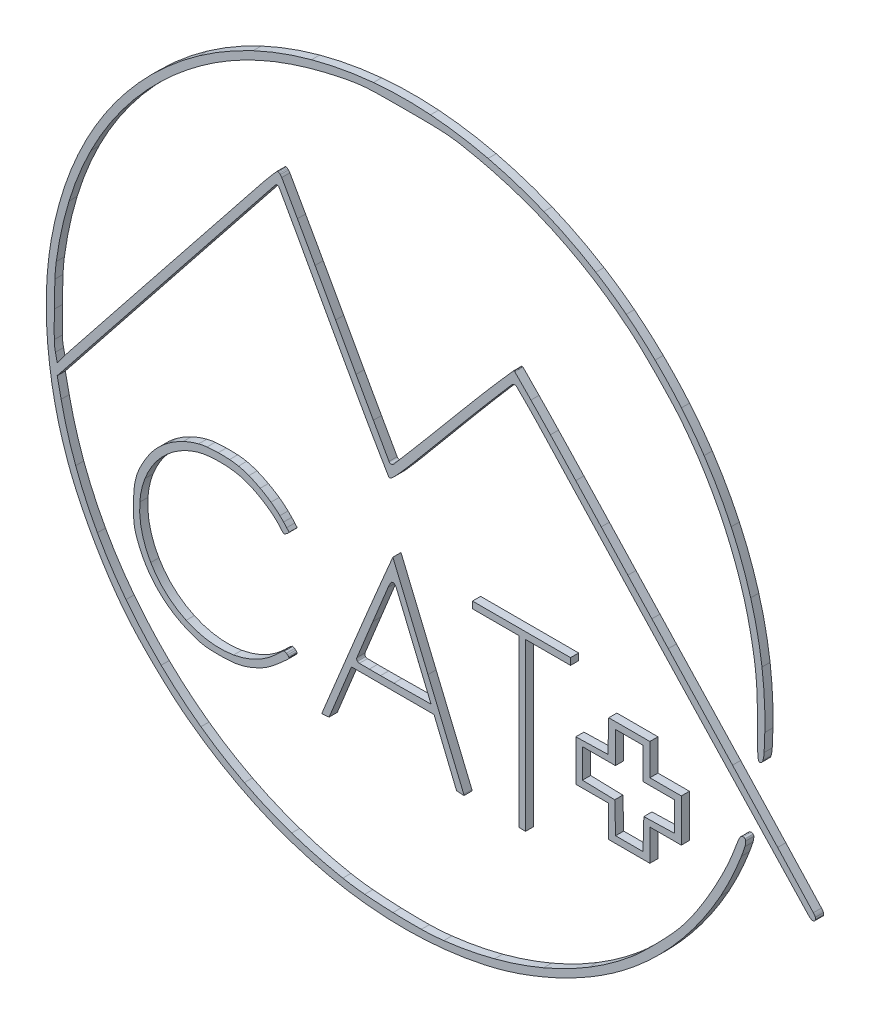
from build123d import *

# Parameters (mm, degrees)
BOSS_EXTRUDE1_DEPTH   = 1.3
BOSS_EXTRUDE1_2_DEPTH = 1.3
BOSS_EXTRUDE1_3_DEPTH = 1.3
BOSS_EXTRUDE1_4_DEPTH = 1.3
BOSS_EXTRUDE1_5_DEPTH = 1.3


with BuildPart() as part:
    # Sketch1 → Boss-Extrude1 (new body)
    with BuildSketch(Plane.XY):
        with BuildLine():
            Line((-31.815838724, 8.425255359), (-33.682591288, 3.900470302))
            Line((-33.682591288, 3.900470302), (-35.328575676, -0.094963077))
            ThreePointArc((-35.328575676, -0.094963077), (-35.391110564, -0.25152532), (-35.450284856, -0.409388398))
            ThreePointArc((-35.450284856, -0.409388398), (-35.229552005, -0.397854852), (-35.009108398, -0.381710805))
            Line((-35.009108398, -0.381710805), (-34.281885857, -0.320806981))
            Line((-34.281885857, -0.320806981), (-32.567121432, 3.880706873))
            Line((-32.567121432, 3.880706873), (-30.706701445, 8.439105823))
            Line((-30.706701445, 8.439105823), (-24.097582966, 8.439105823))
            Line((-24.097582966, 8.439105823), (-17.489142556, 8.439105823))
            Line((-17.489142556, 8.439105823), (-15.612473722, 3.881572554))
            Line((-15.612473722, 3.881572554), (-13.881916352, -0.321125114))
            Line((-13.881916352, -0.321125114), (-13.196712386, -0.379858018))
            ThreePointArc((-13.196712386, -0.379858018), (-13.041807344, -0.390218714), (-12.886623029, -0.3947733))
            ThreePointArc((-12.886623029, -0.3947733), (-12.781426044, -0.393056682), (-12.67647411, -0.38567804))
            ThreePointArc((-12.67647411, -0.38567804), (-12.696631397, -0.311295888), (-12.723189489, -0.238951652))
            Line((-12.723189489, -0.238951652), (-18.454242914, 13.486461288))
            Line((-18.454242914, 13.486461288), (-24.079007465, 26.952053591))
            Line((-24.079007465, 26.952053591), (-25.584755443, 23.397018841))
            ThreePointArc((-25.584755443, 23.397018841), (-26.517769308, 21.185389488), (-27.445091809, 18.971367752))
            ThreePointArc((-27.445091809, 18.971367752), (-28.539429645, 16.343399387), (-29.629692848, 13.713737968))
            Line((-29.629692848, 13.713737968), (-31.815838724, 8.425255359))
        make_face()
        with BuildLine():
            Line((-23.92032783, 9.571350871), (-17.966044582, 9.64093294))
            Line((-17.966044582, 9.64093294), (-20.732755734, 16.279389691))
            ThreePointArc((-20.732755734, 16.279389691), (-21.237325347, 17.489708875), (-21.742139439, 18.69992611))
            Line((-21.742139439, 18.69992611), (-22.625320846, 20.814812018))
            Line((-22.625320846, 20.814812018), (-23.383297854, 22.627703207))
            ThreePointArc((-23.383297854, 22.627703207), (-23.456956867, 22.8021917), (-23.531769074, 22.976188878))
            ThreePointArc((-23.531769074, 22.976188878), (-23.582733412, 23.081511322), (-23.642213646, 23.18226986))
            ThreePointArc((-23.642213646, 23.18226986), (-23.720580769, 23.28125606), (-23.816245789, 23.363644637))
            ThreePointArc((-23.816245789, 23.363644637), (-23.956980287, 23.428590129), (-24.111647193, 23.438702698))
            ThreePointArc((-24.111647193, 23.438702698), (-24.278166717, 23.378915157), (-24.401733002, 23.25228706))
            ThreePointArc((-24.401733002, 23.25228706), (-24.641206142, 22.821415523), (-24.845998227, 22.373020757))
            Line((-24.845998227, 22.373020757), (-27.278105284, 16.425394876))
            Line((-27.278105284, 16.425394876), (-29.834419937, 10.156028065))
            ThreePointArc((-29.834419937, 10.156028065), (-29.857759174, 9.908341994), (-29.740174725, 9.689100102))
            ThreePointArc((-29.740174725, 9.689100102), (-29.602150213, 9.596544093), (-29.439321743, 9.563313566))
            Line((-29.439321743, 9.563313566), (-27.844629137, 9.55355839))
            ThreePointArc((-27.844629137, 9.55355839), (-26.943065988, 9.551122672), (-26.041502523, 9.5534385))
            ThreePointArc((-26.041502523, 9.5534385), (-24.980900659, 9.560675474), (-23.92032783, 9.571350871))
        make_face(mode=Mode.SUBTRACT)
    extrude(amount=BOSS_EXTRUDE1_DEPTH)


with BuildPart() as body_2:
    # Sketch1 → Boss-Extrude1 2 (new body)
    with BuildSketch(Plane.XY):
        Polygon((-3.910313521, 26.165694971), (-3.910313521, 12.57075311), (-3.910313521, -0.424188751), (-3.371893764, -0.424188751), (-2.833474007, -0.424188751), (-2.833474007, 12.57075311), (-2.833474007, 26.165694971), (1.059753523, 26.165694971), (4.352981053, 26.165694971), (4.352981053, 26.704114728), (4.352981053, 27.242534485), (-3.491668015, 27.242534485), (-11.336317083, 27.242534485), (-11.336317083, 26.704114728), (-11.336317083, 26.165694971), (-7.923315302, 26.165694971), align=None)
    extrude(amount=BOSS_EXTRUDE1_2_DEPTH)


with BuildPart() as body_3:
    # Sketch1 → Boss-Extrude1 3 (new body)
    with BuildSketch(Plane.XY):
        Polygon((7.475594057, 16.75428763), (5.192529555, 16.694008143), (5.192529555, 13.401068462), (5.192529555, 10.115945337), (7.527563077, 10.115945337), (10.462596599, 10.115945337), (10.462596599, 7.300686066), (10.462596599, 5.085426795), (13.755824128, 5.085426795), (17.049051658, 5.085426795), (17.049051658, 7.300686066), (17.049051658, 10.115945337), (19.864310929, 10.115945337), (22.0795702, 10.115945337), (22.0795702, 13.528947118), (22.0795702, 16.941948899), (19.864310929, 16.941948899), (17.049051658, 16.941948899), (17.049051658, 19.75720817), (17.049051658, 21.972467441), (13.763928533, 21.972467441), (10.470988852, 21.972467441), (10.410709366, 19.689402939), (10.33520707, 16.829789926), align=None)
        Polygon((9.204402591, 15.865109385), (6.269369069, 15.865109385), (6.269369069, 13.537051523), (6.269369069, 11.216809738), (9.136597359, 11.141106643), (11.42767546, 11.080615361), (11.488044998, 8.909300711), (11.564421398, 6.162266309), (13.755824128, 6.162266309), (15.947226859, 6.162266309), (16.023603259, 8.909300711), (16.083983856, 11.081013139), (18.255696285, 11.141393737), (21.002730686, 11.217770137), (21.002730686, 13.537327243), (21.002730686, 15.865109385), (18.187471415, 15.865109385), (15.972212144, 15.865109385), (15.972212144, 18.080368656), (15.972212144, 20.895627927), (13.755824128, 20.895627927), (11.539436113, 20.895627927), (11.539436113, 18.080368656), (11.539436113, 15.865109385), align=None, mode=Mode.SUBTRACT)
    extrude(amount=BOSS_EXTRUDE1_3_DEPTH)


with BuildPart() as body_4:
    # Sketch1 → Boss-Extrude1 4 (new body)
    with BuildSketch(Plane.XY):
        with BuildLine():
            Line((28.680505607, 25.268543656), (42.484069198, 10.525843179))
            ThreePointArc((42.484069198, 10.525843179), (42.676116553, 10.356318127), (42.896722792, 10.226111302))
            ThreePointArc((42.896722792, 10.226111302), (43.036837537, 10.184887309), (43.182867195, 10.187513807))
            ThreePointArc((43.182867195, 10.187513807), (43.319842008, 10.233441175), (43.436538227, 10.318608158))
            ThreePointArc((43.436538227, 10.318608158), (43.521595885, 10.434543328), (43.567531365, 10.570799339))
            ThreePointArc((43.567531365, 10.570799339), (43.570177454, 10.715594277), (43.529085711, 10.854461279))
            ThreePointArc((43.529085711, 10.854461279), (43.389107636, 11.100844868), (43.213449674, 11.323202724))
            Line((43.213449674, 11.323202724), (37.503851719, 17.51285194))
            ThreePointArc((37.503851719, 17.51285194), (33.89547054, 21.412160992), (30.278340783, 25.303355942))
            Line((30.278340783, 25.303355942), (20.000786453, 36.316706173))
            Line((20.000786453, 36.316706173), (17.371265182, 39.132202231))
            Line((17.371265182, 39.132202231), (13.525684351, 43.254315787))
            Line((13.525684351, 43.254315787), (9.268413789, 47.820240906))
            Line((9.268413789, 47.820240906), (5.195340606, 52.191187157))
            ThreePointArc((5.195340606, 52.191187157), (3.169892585, 54.357924541), (1.136968408, 56.517649031))
            ThreePointArc((1.136968408, 56.517649031), (-0.417548425, 58.150761239), (-1.984610164, 59.771839761))
            ThreePointArc((-1.984610164, 59.771839761), (-3.272327213, 61.091090503), (-4.562656485, 62.407786402))
            ThreePointArc((-4.562656485, 62.407786402), (-4.615439782, 62.443579781), (-4.677960761, 62.456164278))
            ThreePointArc((-4.677960761, 62.456164278), (-4.740692547, 62.442676774), (-4.792337597, 62.404598189))
            ThreePointArc((-4.792337597, 62.404598189), (-5.999188839, 61.03553164), (-7.202805728, 59.663620738))
            ThreePointArc((-7.202805728, 59.663620738), (-8.722792724, 57.912670456), (-10.228498022, 56.14942376))
            ThreePointArc((-10.228498022, 56.14942376), (-12.321481363, 53.67048492), (-14.406844516, 51.185132319))
            ThreePointArc((-14.406844516, 51.185132319), (-16.236071462, 49.001859179), (-18.068859072, 46.821574243))
            ThreePointArc((-18.068859072, 46.821574243), (-19.621860207, 44.982205714), (-21.179807314, 43.147024546))
            Line((-21.179807314, 43.147024546), (-23.981897106, 39.856563162))
            ThreePointArc((-23.981897106, 39.856563162), (-24.135123531, 39.740334842), (-24.322962467, 39.699056589))
            ThreePointArc((-24.322962467, 39.699056589), (-24.533542455, 39.756098897), (-24.686540619, 39.911628053))
            Line((-24.686540619, 39.911628053), (-27.19564382, 44.370458933))
            ThreePointArc((-27.19564382, 44.370458933), (-28.587394583, 46.852147482), (-29.972673324, 49.337454514))
            ThreePointArc((-29.972673324, 49.337454514), (-31.607869506, 52.285598656), (-33.238429188, 55.236309682))
            ThreePointArc((-33.238429188, 55.236309682), (-34.876799211, 58.200764007), (-36.520159048, 61.162455116))
            ThreePointArc((-36.520159048, 61.162455116), (-37.932068217, 63.693990942), (-39.350746614, 66.221739495))
            Line((-39.350746614, 66.221739495), (-41.858350193, 70.670115722))
            ThreePointArc((-41.858350193, 70.670115722), (-41.963304128, 70.83061318), (-42.088245517, 70.976093112))
            ThreePointArc((-42.088245517, 70.976093112), (-42.152084602, 71.034445058), (-42.221989828, 71.085372829))
            ThreePointArc((-42.221989828, 71.085372829), (-42.296600768, 71.127919418), (-42.375493229, 71.161875039))
            ThreePointArc((-42.375493229, 71.161875039), (-42.442843329, 71.181905003), (-42.512141161, 71.193525931))
            ThreePointArc((-42.512141161, 71.193525931), (-42.527436998, 71.193325825), (-42.542263754, 71.189561523))
            ThreePointArc((-42.542263754, 71.189561523), (-42.600386043, 71.158853791), (-42.649574125, 71.11524533))
            ThreePointArc((-42.649574125, 71.11524533), (-43.06109761, 70.648670322), (-43.469792687, 70.179615793))
            ThreePointArc((-43.469792687, 70.179615793), (-43.945955175, 69.622716397), (-44.415046327, 69.059847723))
            ThreePointArc((-44.415046327, 69.059847723), (-44.945359092, 68.409682413), (-45.470135327, 67.755040173))
            Line((-45.470135327, 67.755040173), (-47.192464721, 65.58979085))
            Line((-47.192464721, 65.58979085), (-51.492662408, 60.189397523))
            Line((-51.492662408, 60.189397523), (-56.621686965, 53.749412526))
            Line((-56.621686965, 53.749412526), (-62.190153691, 46.759073506))
            Line((-62.190153691, 46.759073506), (-67.609123391, 39.952687203))
            Line((-67.609123391, 39.952687203), (-72.269670896, 34.089372843))
            Line((-72.269670896, 34.089372843), (-76.339105294, 28.96333216))
            ThreePointArc((-76.339105294, 28.96333216), (-76.572370847, 28.663987988), (-76.800267428, 28.360536345))
            Line((-76.800267428, 28.360536345), (-77.781718408, 27.029172265))
            Line((-77.781718408, 27.029172265), (-78.076102453, 28.35368493))
            ThreePointArc((-78.076102453, 28.35368493), (-78.213885922, 29.178299976), (-78.263408579, 30.01287877))
            ThreePointArc((-78.263408579, 30.01287877), (-78.267254701, 32.127745865), (-78.252892013, 34.242567686))
            ThreePointArc((-78.252892013, 34.242567686), (-78.217107794, 36.345438106), (-78.156437377, 38.447737708))
            ThreePointArc((-78.156437377, 38.447737708), (-78.08040583, 39.7251138), (-77.94143361, 40.99718188))
            ThreePointArc((-77.94143361, 40.99718188), (-77.108822901, 45.73877938), (-75.896931242, 50.397889387))
            ThreePointArc((-75.896931242, 50.397889387), (-74.333286218, 54.851971882), (-72.394400419, 59.155988437))
            ThreePointArc((-72.394400419, 59.155988437), (-70.099602686, 63.268081973), (-67.460576153, 67.168203618))
            ThreePointArc((-67.460576153, 67.168203618), (-64.458660186, 70.889485992), (-61.162117528, 74.35246859))
            ThreePointArc((-61.162117528, 74.35246859), (-58.077428316, 77.133311455), (-54.803808083, 79.689051103))
            ThreePointArc((-54.803808083, 79.689051103), (-51.431340081, 81.944498124), (-47.897307536, 83.937284031))
            ThreePointArc((-47.897307536, 83.937284031), (-44.180374156, 85.677692756), (-40.343445323, 87.134605044))
            ThreePointArc((-40.343445323, 87.134605044), (-36.235766889, 88.372097974), (-32.055869453, 89.337949042))
            ThreePointArc((-32.055869453, 89.337949042), (-31.015895753, 89.530850711), (-29.971958601, 89.701002324))
            ThreePointArc((-29.971958601, 89.701002324), (-29.126969443, 89.810992376), (-28.278075634, 89.885045003))
            ThreePointArc((-28.278075634, 89.885045003), (-27.226744143, 89.939842254), (-26.174304611, 89.96575894))
            ThreePointArc((-26.174304611, 89.96575894), (-24.175651878, 89.982904529), (-22.176941183, 89.990796222))
            ThreePointArc((-22.176941183, 89.990796222), (-20.410115625, 89.98900776), (-18.643324271, 89.977869348))
            ThreePointArc((-18.643324271, 89.977869348), (-17.515639321, 89.956942061), (-16.388564568, 89.914353301))
            ThreePointArc((-16.388564568, 89.914353301), (-15.541535317, 89.861757038), (-14.696408917, 89.784385926))
            ThreePointArc((-14.696408917, 89.784385926), (-13.915911322, 89.686687101), (-13.13958495, 89.560042242))
            ThreePointArc((-13.13958495, 89.560042242), (-9.31011007, 88.74650119), (-5.534293157, 87.71212527))
            ThreePointArc((-5.534293157, 87.71212527), (-1.971228296, 86.495193484), (1.504682, 85.047988663))
            ThreePointArc((1.504682, 85.047988663), (4.806259654, 83.40933124), (7.990801623, 81.553447191))
            ThreePointArc((7.990801623, 81.553447191), (11.042007218, 79.48974855), (13.948010558, 77.226155777))
            ThreePointArc((13.948010558, 77.226155777), (14.918202137, 76.387659041), (15.858618143, 75.515898633))
            ThreePointArc((15.858618143, 75.515898633), (17.06001226, 74.344574436), (18.243017213, 73.154680541))
            ThreePointArc((18.243017213, 73.154680541), (19.403578828, 71.950452132), (20.545280408, 70.728328232))
            ThreePointArc((20.545280408, 70.728328232), (21.382110548, 69.784827806), (22.18431907, 68.811719785))
            ThreePointArc((22.18431907, 68.811719785), (24.130113588, 66.200163882), (25.91020924, 63.472967518))
            ThreePointArc((25.91020924, 63.472967518), (27.565192497, 60.572549748), (29.050847666, 57.581860607))
            ThreePointArc((29.050847666, 57.581860607), (30.368162709, 54.497981574), (31.506913201, 51.343797666))
            ThreePointArc((31.506913201, 51.343797666), (32.442759573, 48.181515256), (33.186528443, 44.968627717))
            ThreePointArc((33.186528443, 44.968627717), (33.473344357, 43.459341829), (33.731213565, 41.94484167))
            ThreePointArc((33.731213565, 41.94484167), (33.911010619, 40.687495998), (34.047857809, 39.424753758))
            ThreePointArc((34.047857809, 39.424753758), (34.150112492, 38.074092014), (34.210868859, 36.720928378))
            ThreePointArc((34.210868859, 36.720928378), (34.253547782, 34.887412356), (34.273301651, 33.053506067))
            ThreePointArc((34.273301651, 33.053506067), (34.283552406, 31.304275651), (34.298491054, 29.555078989))
            ThreePointArc((34.298491054, 29.555078989), (34.316637865, 28.976278438), (34.359606745, 28.398789858))
            ThreePointArc((34.359606745, 28.398789858), (34.40157349, 28.161234717), (34.480452003, 27.9332614))
            ThreePointArc((34.480452003, 27.9332614), (34.50440881, 27.902797624), (34.540163675, 27.887845706))
            ThreePointArc((34.540163675, 27.887845706), (34.72568638, 27.899660244), (34.891036498, 27.984616679))
            ThreePointArc((34.891036498, 27.984616679), (35.052392771, 28.164511425), (35.149175954, 28.385940831))
            ThreePointArc((35.149175954, 28.385940831), (35.270159522, 28.976952147), (35.330801695, 29.577163715))
            ThreePointArc((35.330801695, 29.577163715), (35.393493021, 30.993830548), (35.439582944, 32.411134622))
            ThreePointArc((35.439582944, 32.411134622), (35.386410627, 36.844432843), (34.991090661, 41.260390558))
            ThreePointArc((34.991090661, 41.260390558), (34.255671433, 45.638506662), (33.18568406, 49.947087528))
            ThreePointArc((33.18568406, 49.947087528), (31.789001915, 54.155294266), (30.072379251, 58.243439517))
            ThreePointArc((30.072379251, 58.243439517), (28.051860107, 62.171768161), (25.73163135, 65.930864072))
            ThreePointArc((25.73163135, 65.930864072), (23.982833987, 68.38495177), (22.103298723, 70.740410501))
            ThreePointArc((22.103298723, 70.740410501), (20.055880308, 73.046458675), (17.894025897, 75.245587106))
            ThreePointArc((17.894025897, 75.245587106), (15.634287261, 77.321548396), (13.271609837, 79.279554876))
            ThreePointArc((13.271609837, 79.279554876), (10.888096995, 81.048136434), (8.408895707, 82.679876354))
            ThreePointArc((8.408895707, 82.679876354), (4.337559085, 84.977193578), (0.094726491, 86.939798961))
            ThreePointArc((0.094726491, 86.939798961), (-4.31432095, 88.56625625), (-8.838274694, 89.838618293))
            ThreePointArc((-8.838274694, 89.838618293), (-13.413807308, 90.740539492), (-18.046703545, 91.274611587))
            ThreePointArc((-18.046703545, 91.274611587), (-22.614579275, 91.423038283), (-27.178630305, 91.184380882))
            ThreePointArc((-27.178630305, 91.184380882), (-32.170691964, 90.49649303), (-37.086712509, 89.388968179))
            ThreePointArc((-37.086712509, 89.388968179), (-41.839152901, 87.879341513), (-46.441847896, 85.961045101))
            ThreePointArc((-46.441847896, 85.961045101), (-50.849613478, 83.653408202), (-55.03879638, 80.969319511))
            ThreePointArc((-55.03879638, 80.969319511), (-59.004875678, 77.913172314), (-62.694107056, 74.527999861))
            ThreePointArc((-62.694107056, 74.527999861), (-65.711423304, 71.271345038), (-68.471868576, 67.794285953))
            ThreePointArc((-68.471868576, 67.794285953), (-70.94638108, 64.132267811), (-73.130829203, 60.290162217))
            ThreePointArc((-73.130829203, 60.290162217), (-75.013149494, 56.289016516), (-76.581151099, 52.154567634))
            ThreePointArc((-76.581151099, 52.154567634), (-77.834824864, 47.889220178), (-78.760958477, 43.540983367))
            ThreePointArc((-78.760958477, 43.540983367), (-79.26050293, 39.927650772), (-79.509981488, 36.288491865))
            ThreePointArc((-79.509981488, 36.288491865), (-79.52150186, 32.503897721), (-79.298995751, 28.725832531))
            ThreePointArc((-79.298995751, 28.725832531), (-78.843268914, 24.968282591), (-78.156104068, 21.246096006))
            ThreePointArc((-78.156104068, 21.246096006), (-77.260635601, 17.708570122), (-76.123843492, 14.241055615))
            ThreePointArc((-76.123843492, 14.241055615), (-75.284426843, 12.104748141), (-74.34699275, 10.009599636))
            ThreePointArc((-74.34699275, 10.009599636), (-73.228949627, 7.76257788), (-72.031535873, 5.556829141))
            ThreePointArc((-72.031535873, 5.556829141), (-70.759512133, 3.400812394), (-69.411319709, 1.291587464))
            ThreePointArc((-69.411319709, 1.291587464), (-68.10751585, -0.573016095), (-66.71710962, -2.373966248))
            ThreePointArc((-66.71710962, -2.373966248), (-65.707300059, -3.572374269), (-64.652418173, -4.731305388))
            ThreePointArc((-64.652418173, -4.731305388), (-63.361537627, -6.064603232), (-62.039852021, -7.367370628))
            ThreePointArc((-62.039852021, -7.367370628), (-60.685425322, -8.641414252), (-59.301615492, -9.883480753))
            ThreePointArc((-59.301615492, -9.883480753), (-58.094769257, -10.902051584), (-56.850493029, -11.874543763))
            ThreePointArc((-56.850493029, -11.874543763), (-51.616987139, -15.395640785), (-46.04402995, -18.350273811))
            ThreePointArc((-46.04402995, -18.350273811), (-40.286742556, -20.649998341), (-34.31148366, -22.30268469))
            ThreePointArc((-34.31148366, -22.30268469), (-28.18426594, -23.289733982), (-21.985707042, -23.59784254))
            ThreePointArc((-21.985707042, -23.59784254), (-15.669694434, -23.235027326), (-9.425511536, -22.218252971))
            ThreePointArc((-9.425511536, -22.218252971), (-6.563436795, -21.506623556), (-3.749646508, -20.62318003))
            ThreePointArc((-3.749646508, -20.62318003), (-0.806280053, -19.516750595), (2.077909806, -18.264136913))
            ThreePointArc((2.077909806, -18.264136913), (4.920377395, -16.856898731), (7.68927923, -15.309926228))
            ThreePointArc((7.68927923, -15.309926228), (10.252875141, -13.692550323), (12.720377223, -11.932049742))
            ThreePointArc((12.720377223, -11.932049742), (15.795735731, -9.423515775), (18.68222489, -6.699776994))
            ThreePointArc((18.68222489, -6.699776994), (21.432794398, -3.714754043), (23.975611241, -0.550883448))
            ThreePointArc((23.975611241, -0.550883448), (26.29366306, 2.770163398), (28.381761935, 6.240402508))
            ThreePointArc((28.381761935, 6.240402508), (30.17128577, 9.752914386), (31.698857813, 13.387011096))
            ThreePointArc((31.698857813, 13.387011096), (31.989765229, 14.190946835), (32.257909996, 15.0027585))
            ThreePointArc((32.257909996, 15.0027585), (32.353976321, 15.415039981), (32.386502267, 15.837114407))
            ThreePointArc((32.386502267, 15.837114407), (32.356828044, 15.983350994), (32.272277523, 16.10630183))
            ThreePointArc((32.272277523, 16.10630183), (32.138706831, 16.192949724), (31.982413383, 16.223303393))
            ThreePointArc((31.982413383, 16.223303393), (31.852557407, 16.205861543), (31.731906202, 16.154772606))
            ThreePointArc((31.731906202, 16.154772606), (31.608835733, 16.06160133), (31.509993967, 15.943036865))
            ThreePointArc((31.509993967, 15.943036865), (31.344465045, 15.661390428), (31.207674964, 15.364720555))
            ThreePointArc((31.207674964, 15.364720555), (30.944474944, 14.696257915), (30.691037806, 14.024033124))
            ThreePointArc((30.691037806, 14.024033124), (29.948497662, 12.151022285), (29.116266417, 10.316103589))
            ThreePointArc((29.116266417, 10.316103589), (28.080809842, 8.257579481), (26.979764285, 6.23337828))
            ThreePointArc((26.979764285, 6.23337828), (25.809797066, 4.237818599), (24.576458019, 2.280791127))
            ThreePointArc((24.576458019, 2.280791127), (23.420086531, 0.597018496), (22.186122419, -1.030746188))
            ThreePointArc((22.186122419, -1.030746188), (21.381967371, -2.005060998), (20.543384504, -2.949906735))
            ThreePointArc((20.543384504, -2.949906735), (19.401113476, -4.172189816), (18.240032996, -5.376619619))
            ThreePointArc((18.240032996, -5.376619619), (17.057255637, -6.566061548), (15.856154664, -7.73699743))
            ThreePointArc((15.856154664, -7.73699743), (14.916946516, -8.607612551), (13.948010297, -9.445016419))
            ThreePointArc((13.948010297, -9.445016419), (10.737981272, -11.92463614), (7.350798333, -14.156180903))
            ThreePointArc((7.350798333, -14.156180903), (3.75923897, -16.160164676), (0.032741227, -17.900412987))
            ThreePointArc((0.032741227, -17.900412987), (-3.836266665, -19.379336891), (-7.801067855, -20.577998438))
            ThreePointArc((-7.801067855, -20.577998438), (-11.840076128, -21.489815686), (-15.933961969, -22.11037772))
            ThreePointArc((-15.933961969, -22.11037772), (-17.722934048, -22.270873741), (-19.517715225, -22.341163105))
            ThreePointArc((-19.517715225, -22.341163105), (-21.788332197, -22.34469483), (-24.058336053, -22.291813887))
            ThreePointArc((-24.058336053, -22.291813887), (-26.319931125, -22.182880598), (-28.578124408, -22.017829619))
            ThreePointArc((-28.578124408, -22.017829619), (-30.340350046, -21.820914526), (-32.090013338, -21.533002879))
            ThreePointArc((-32.090013338, -21.533002879), (-36.219722128, -20.59578668), (-40.275797157, -19.378772195))
            ThreePointArc((-40.275797157, -19.378772195), (-44.119156947, -17.918636069), (-47.842651581, -16.175363373))
            ThreePointArc((-47.842651581, -16.175363373), (-51.400778992, -14.171259936), (-54.797897982, -11.904922843))
            ThreePointArc((-54.797897982, -11.904922843), (-58.075399221, -9.351949866), (-61.162117802, -6.571328749))
            ThreePointArc((-61.162117802, -6.571328749), (-64.086780942, -3.527687791), (-66.782958809, -0.279914758))
            ThreePointArc((-66.782958809, -0.279914758), (-69.20502509, 3.119914895), (-71.365117574, 6.691923742))
            ThreePointArc((-71.365117574, 6.691923742), (-73.244994801, 10.405119721), (-74.839981322, 14.249307642))
            ThreePointArc((-74.839981322, 14.249307642), (-76.150825382, 18.223929269), (-77.163886848, 22.284672514))
            Line((-77.163886848, 22.284672514), (-77.78833776, 25.251579129))
            Line((-77.78833776, 25.251579129), (-60.322772178, 47.206721328))
            Line((-60.322772178, 47.206721328), (-53.654699727, 55.588589147))
            Line((-53.654699727, 55.588589147), (-48.030081863, 62.658251687))
            Line((-48.030081863, 62.658251687), (-42.931373145, 69.066563377))
            Line((-42.931373145, 69.066563377), (-42.875121254, 69.135760534))
            ThreePointArc((-42.875121254, 69.135760534), (-42.561712905, 69.267351905), (-42.275879518, 69.083390496))
            Line((-42.275879518, 69.083390496), (-41.337610748, 67.417428929))
            ThreePointArc((-41.337610748, 67.417428929), (-40.494886967, 65.907915595), (-39.656644559, 64.395909133))
            Line((-39.656644559, 64.395909133), (-33.075680531, 52.480834979))
            ThreePointArc((-33.075680531, 52.480834979), (-31.08313028, 48.881598315), (-29.08280313, 45.28667796))
            ThreePointArc((-29.08280313, 45.28667796), (-27.849413445, 43.098116355), (-26.597047733, 40.920357842))
            ThreePointArc((-26.597047733, 40.920357842), (-25.689629987, 39.36459739), (-24.776654663, 37.8120918))
            ThreePointArc((-24.776654663, 37.8120918), (-24.713202822, 37.744780258), (-24.626955471, 37.711338155))
            ThreePointArc((-24.626955471, 37.711338155), (-24.42786068, 37.72748734), (-24.256288418, 37.829773659))
            ThreePointArc((-24.256288418, 37.829773659), (-23.641688365, 38.443766846), (-23.050824655, 39.080634914))
            ThreePointArc((-23.050824655, 39.080634914), (-21.935651744, 40.349411182), (-20.840701228, 41.635679897))
            Line((-20.840701228, 41.635679897), (-14.035856524, 49.773342928))
            ThreePointArc((-14.035856524, 49.773342928), (-12.321931507, 51.821121842), (-10.602630986, 53.864389608))
            ThreePointArc((-10.602630986, 53.864389608), (-9.137040853, 55.593974449), (-7.664057972, 57.317267689))
            Line((-7.664057972, 57.317267689), (-5.037893656, 60.373004436))
            ThreePointArc((-5.037893656, 60.373004436), (-4.868462886, 60.510342385), (-4.661611995, 60.579488664))
            ThreePointArc((-4.661611995, 60.579488664), (-4.420990619, 60.558147182), (-4.215306896, 60.431465254))
            ThreePointArc((-4.215306896, 60.431465254), (-3.534513963, 59.750929667), (-2.855615547, 59.06850411))
            ThreePointArc((-2.855615547, 59.06850411), (-2.077192748, 58.275417858), (-1.30730189, 57.474046582))
            ThreePointArc((-1.30730189, 57.474046582), (-0.413875101, 56.527781089), (0.473227912, 55.575584652))
            ThreePointArc((0.473227912, 55.575584652), (7.541764421, 47.948332288), (14.621063558, 40.331068295))
            ThreePointArc((14.621063558, 40.331068295), (21.64531689, 32.794702402), (28.680505607, 25.268543656))
        make_face()
    extrude(amount=BOSS_EXTRUDE1_4_DEPTH)


with BuildPart() as body_5:
    # Sketch1 → Boss-Extrude1 5 (new body)
    with BuildSketch(Plane.XY):
        with BuildLine():
            ThreePointArc((-49.564230355, 0.657068959), (-45.877622464, 1.888829984), (-42.721928735, 4.158171311))
            ThreePointArc((-42.721928735, 4.158171311), (-42.271187975, 4.593825464), (-41.815629038, 5.02443878))
            ThreePointArc((-41.815629038, 5.02443878), (-41.663409813, 5.147989041), (-41.495462976, 5.249128643))
            ThreePointArc((-41.495462976, 5.249128643), (-41.448057889, 5.263368184), (-41.398677806, 5.259960213))
            ThreePointArc((-41.398677806, 5.259960213), (-41.250784404, 5.208979414), (-41.113302281, 5.134345868))
            ThreePointArc((-41.113302281, 5.134345868), (-41.015801564, 5.066691951), (-40.922031583, 4.993955213))
            ThreePointArc((-40.922031583, 4.993955213), (-40.842349633, 4.924202751), (-40.767402322, 4.849386178))
            ThreePointArc((-40.767402322, 4.849386178), (-40.723987313, 4.800491971), (-40.683317788, 4.749291422))
            ThreePointArc((-40.683317788, 4.749291422), (-40.724237001, 4.595176128), (-40.818268499, 4.466397313))
            ThreePointArc((-40.818268499, 4.466397313), (-41.536950686, 3.804370122), (-42.26889539, 3.157036332))
            ThreePointArc((-42.26889539, 3.157036332), (-43.028750033, 2.521171414), (-43.810032246, 1.911826377))
            ThreePointArc((-43.810032246, 1.911826377), (-44.40338779, 1.501990719), (-45.028112882, 1.141776023))
            ThreePointArc((-45.028112882, 1.141776023), (-45.89673449, 0.712195311), (-46.784221301, 0.323080614))
            ThreePointArc((-46.784221301, 0.323080614), (-47.540679467, 0.045289013), (-48.316145199, -0.17391416))
            ThreePointArc((-48.316145199, -0.17391416), (-49.110490352, -0.334374213), (-49.914713158, -0.434160637))
            ThreePointArc((-49.914713158, -0.434160637), (-50.896147687, -0.496294029), (-51.879375955, -0.514637057))
            ThreePointArc((-51.879375955, -0.514637057), (-52.567786921, -0.505448247), (-53.255889431, -0.482886612))
            ThreePointArc((-53.255889431, -0.482886612), (-53.733203753, -0.450106632), (-54.208160224, -0.392488572))
            ThreePointArc((-54.208160224, -0.392488572), (-54.63227049, -0.316531212), (-55.050977348, -0.214926068))
            ThreePointArc((-55.050977348, -0.214926068), (-55.554584285, -0.066563196), (-56.052520665, 0.099842487))
            ThreePointArc((-56.052520665, 0.099842487), (-57.606666613, 0.745970138), (-59.082969054, 1.554290415))
            ThreePointArc((-59.082969054, 1.554290415), (-60.415368845, 2.491389847), (-61.629194767, 3.577700658))
            ThreePointArc((-61.629194767, 3.577700658), (-62.70648136, 4.797009114), (-63.633772784, 6.13394222))
            ThreePointArc((-63.633772784, 6.13394222), (-64.429191223, 7.611089696), (-65.06122609, 9.165176914))
            ThreePointArc((-65.06122609, 9.165176914), (-65.208601378, 9.625154519), (-65.335274114, 10.091258466))
            ThreePointArc((-65.335274114, 10.091258466), (-65.425546907, 10.509926942), (-65.490009969, 10.93333807))
            ThreePointArc((-65.490009969, 10.93333807), (-65.539923756, 11.44591011), (-65.565831319, 11.960254626))
            ThreePointArc((-65.565831319, 11.960254626), (-65.581141786, 12.744118204), (-65.584809262, 13.528122713))
            ThreePointArc((-65.584809262, 13.528122713), (-65.555947818, 14.663085569), (-65.475658331, 15.795572773))
            ThreePointArc((-65.475658331, 15.795572773), (-65.353779369, 16.667928511), (-65.153370217, 17.525655267))
            ThreePointArc((-65.153370217, 17.525655267), (-64.878259535, 18.353325782), (-64.528258789, 19.152214916))
            ThreePointArc((-64.528258789, 19.152214916), (-64.014141936, 20.132675456), (-63.453541915, 21.08732022))
            ThreePointArc((-63.453541915, 21.08732022), (-62.726009663, 22.13862189), (-61.896455616, 23.111441742))
            ThreePointArc((-61.896455616, 23.111441742), (-60.949405401, 24.025895825), (-59.921577848, 24.848514146))
            ThreePointArc((-59.921577848, 24.848514146), (-58.810134378, 25.580696728), (-57.636162283, 26.207743329))
            ThreePointArc((-57.636162283, 26.207743329), (-56.418347073, 26.719270258), (-55.157940106, 27.114375258))
            ThreePointArc((-55.157940106, 27.114375258), (-54.49258324, 27.260613874), (-53.817579205, 27.35256518))
            ThreePointArc((-53.817579205, 27.35256518), (-52.923427865, 27.420336652), (-52.02732979, 27.453620753))
            ThreePointArc((-52.02732979, 27.453620753), (-51.119425957, 27.452340035), (-50.212246062, 27.41606813))
            ThreePointArc((-50.212246062, 27.41606813), (-49.492071443, 27.347338303), (-48.778685465, 27.227106365))
            ThreePointArc((-48.778685465, 27.227106365), (-47.938110131, 27.015893175), (-47.118951834, 26.732772018))
            ThreePointArc((-47.118951834, 26.732772018), (-46.199571403, 26.338260602), (-45.304849714, 25.890630471))
            ThreePointArc((-45.304849714, 25.890630471), (-44.424189253, 25.383880739), (-43.574371149, 24.826954059))
            ThreePointArc((-43.574371149, 24.826954059), (-42.843574389, 24.27410128), (-42.157519107, 23.666616095))
            ThreePointArc((-42.157519107, 23.666616095), (-41.858323605, 23.37518762), (-41.564408803, 23.078434197))
            ThreePointArc((-41.564408803, 23.078434197), (-41.312892453, 22.813057257), (-41.068374416, 22.541218474))
            ThreePointArc((-41.068374416, 22.541218474), (-40.877358025, 22.319528153), (-40.690047282, 22.094698116))
            ThreePointArc((-40.690047282, 22.094698116), (-40.735660199, 22.03135151), (-40.785376475, 21.971171592))
            ThreePointArc((-40.785376475, 21.971171592), (-40.865266306, 21.887069893), (-40.951005858, 21.80894045))
            ThreePointArc((-40.951005858, 21.80894045), (-41.050154945, 21.730030002), (-41.153963227, 21.657357855))
            ThreePointArc((-41.153963227, 21.657357855), (-41.325092831, 21.554772276), (-41.503875972, 21.466196147))
            ThreePointArc((-41.503875972, 21.466196147), (-41.509526268, 21.464928399), (-41.51522571, 21.4659528))
            ThreePointArc((-41.51522571, 21.4659528), (-41.592708478, 21.50723421), (-41.659038091, 21.564750441))
            ThreePointArc((-41.659038091, 21.564750441), (-41.93023863, 21.864758045), (-42.195982736, 22.169609427))
            ThreePointArc((-42.195982736, 22.169609427), (-42.6739261, 22.681103915), (-43.19455762, 23.149077517))
            ThreePointArc((-43.19455762, 23.149077517), (-43.834162868, 23.647482105), (-44.499436, 24.111069926))
            ThreePointArc((-44.499436, 24.111069926), (-45.222601962, 24.560581757), (-45.967976158, 24.97222141))
            ThreePointArc((-45.967976158, 24.97222141), (-46.703712734, 25.326961668), (-47.459099361, 25.63767054))
            ThreePointArc((-47.459099361, 25.63767054), (-48.398017767, 25.935081416), (-49.363503697, 26.129652537))
            ThreePointArc((-49.363503697, 26.129652537), (-50.4899697, 26.255148083), (-51.622356023, 26.303892339))
            ThreePointArc((-51.622356023, 26.303892339), (-52.762348813, 26.275615976), (-53.897816859, 26.170281122))
            ThreePointArc((-53.897816859, 26.170281122), (-54.886727934, 25.992714355), (-55.852247189, 25.714779763))
            ThreePointArc((-55.852247189, 25.714779763), (-57.582323302, 24.971093119), (-59.183057635, 23.979184467))
            ThreePointArc((-59.183057635, 23.979184467), (-60.637043122, 22.751923671), (-61.900138007, 21.328956994))
            ThreePointArc((-61.900138007, 21.328956994), (-62.947220588, 19.73844997), (-63.75579524, 18.014413556))
            ThreePointArc((-63.75579524, 18.014413556), (-64.300309893, 16.207588987), (-64.572438412, 14.34022258))
            ThreePointArc((-64.572438412, 14.34022258), (-64.265035427, 10.456178459), (-62.825780086, 6.835565335))
            ThreePointArc((-62.825780086, 6.835565335), (-60.38670927, 3.817590235), (-57.157565355, 1.665877029))
            ThreePointArc((-57.157565355, 1.665877029), (-53.438174066, 0.579812143), (-49.564230355, 0.657068959))
        make_face()
    extrude(amount=BOSS_EXTRUDE1_5_DEPTH)


solid = Compound([part.part, body_2.part, body_3.part, body_4.part, body_5.part])
